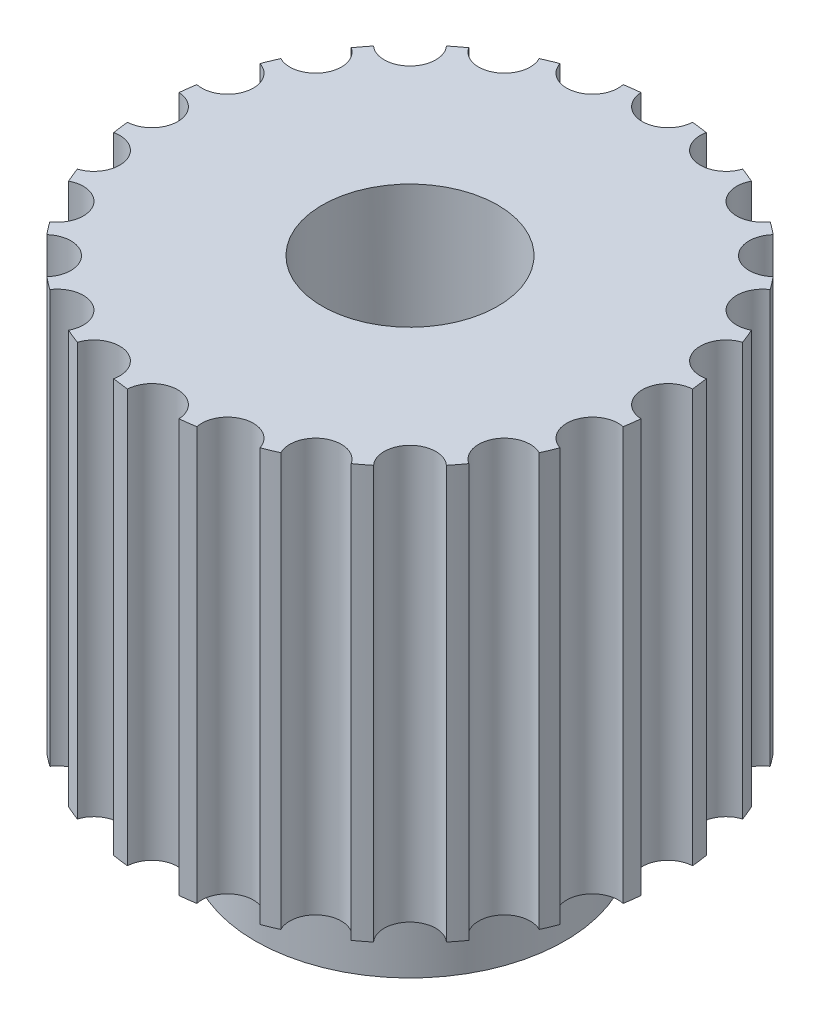
from build123d import *

# Parameters (mm, degrees)
CUT_EXTRUDE2_START        = -3
SKETCH3_R                 = 3
CUT_EXTRUDE2_DEPTH        = 2
M3X0_5_TAPPED_HOLE1_D     = 2.5
M3X0_5_TAPPED_HOLE1_DEPTH = 3
M3X0_5_TAPPED_HOLE1_TIP   = 0.751075774
CUT_EXTRUDE3_DEPTH        = 13.24744888
CIRPATTERN1_COUNT         = 24


with BuildPart() as part:
    # Sketch2 → Revolve2 (revolve)
    with BuildSketch(Plane.XY):
        Polygon((1.7, -5), (3, -5), (3, -3), (5, -3), (5, 5), (1.7, 5), align=None)
    revolve(axis=Axis((0, -5, 0), (0, 1, 0)))

    # Sketch3 → Cut-Extrude2 (cut)
    with BuildSketch(Plane(origin=(0, 0, 0), x_dir=(0, 0, -1), z_dir=(1, 0, 0)).offset(CUT_EXTRUDE2_START)):
        with Locations((0, 1)):
            Circle(SKETCH3_R)
    extrude(amount=-CUT_EXTRUDE2_DEPTH, mode=Mode.SUBTRACT)

    # M3x0.5 Tapped Hole1
    with Locations(Plane.ZY.offset(3)):
        with Locations((0, 1)):
            Hole(M3X0_5_TAPPED_HOLE1_D / 2, depth=M3X0_5_TAPPED_HOLE1_DEPTH)
            with Locations((0, 0, -(M3X0_5_TAPPED_HOLE1_DEPTH + M3X0_5_TAPPED_HOLE1_TIP / 2))):  # 118° drill point
                Cone(0, M3X0_5_TAPPED_HOLE1_D / 2, M3X0_5_TAPPED_HOLE1_TIP, mode=Mode.SUBTRACT)

    # Sketch6 → Cut-Extrude3 (cut, through all)
    with BuildSketch(Plane(origin=(0, 5, 0), x_dir=(1, 0, 0), z_dir=(0, 1, 0))):
        with BuildLine():
            ThreePointArc((-0.499374609, 4.975), (0, 4.5), (0.499374609, 4.975))
            ThreePointArc((0.499374609, 4.975), (0, 5), (-0.499374609, 4.975))
        make_face()
    cut_extrude3 = extrude(amount=-CUT_EXTRUDE3_DEPTH, mode=Mode.SUBTRACT)

    # CirPattern1: Cut-Extrude3 ×24 about axis
    cirpattern1_axis = Axis((0, 5, 0), (0, -1, 0))
    for i in range(1, CIRPATTERN1_COUNT):
        add(cut_extrude3.rotate(cirpattern1_axis, i * 360 / CIRPATTERN1_COUNT), mode=Mode.SUBTRACT)


solid = part.part
